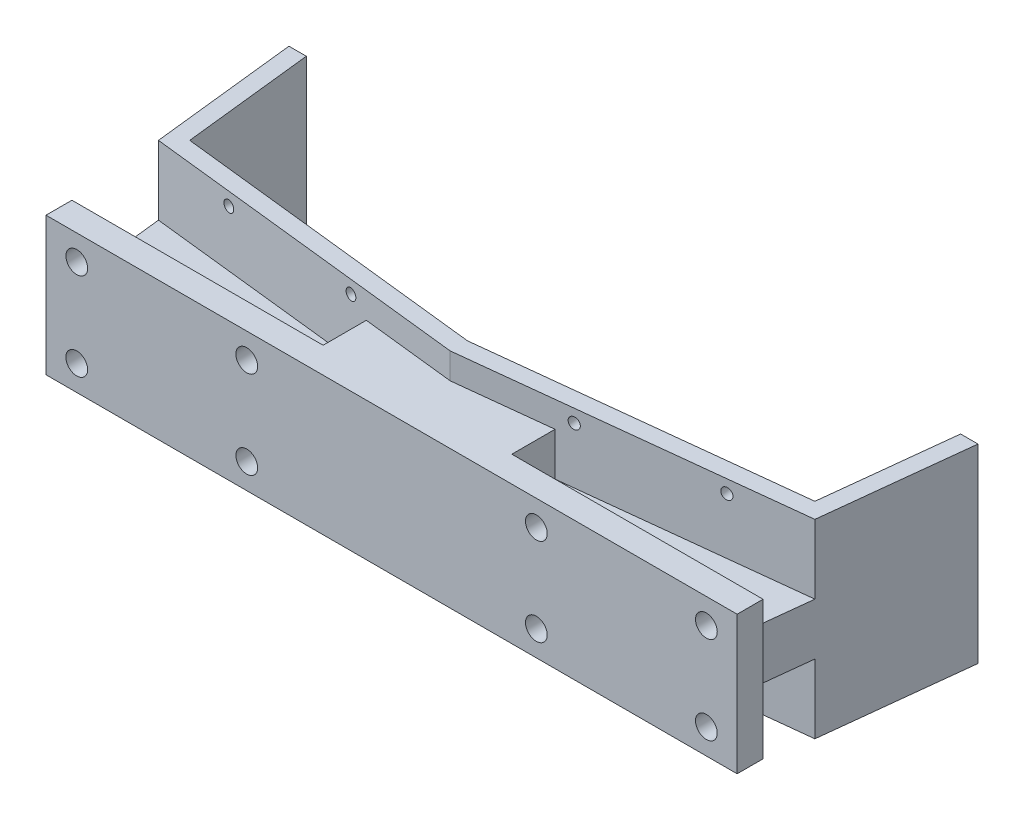
from build123d import *

# Parameters (mm, degrees)
SKETCH1_W                        = 200
SKETCH1_H                        = 40
BOSS_EXTRUDE1_DEPTH              = 12.5
SKETCH3_W                        = 200
SKETCH3_H                        = 12.5
CUT_EXTRUDE1_DEPTH               = 12.5
CUT_EXTRUDE2_REACH               = 107
SKETCH2_R                        = 3.15
SKETCH5_W                        = 200
SKETCH5_H                        = 55
BOSS_EXTRUDE2_DEPTH              = 50
CAVITY1_START                    = -21.65
CAVITY1_DEPTH                    = 43.2999999
CAVITY1_START_2                  = 25.85
CAVITY1_2_DEPTH                  = 1.65
CAVITY1_START_3                  = -27.5
CAVITY1_3_DEPTH                  = 1.6499999
CAVITY1_START_4                  = -25.8500001
CAVITY1_4_DEPTH                  = 51.7000001
CUT_EXTRUDE11_DEPTH              = 55
CUT_EXTRUDE6_REACH               = 216.911
CUT_EXTRUDE6_OFFSET_FROM_SURFACE = 5
SKETCH8_W                        = 62.5
SKETCH8_H                        = 55
CUT_EXTRUDE7_REACH               = 122.136
CUT_EXTRUDE7_OFFSET_FROM_SURFACE = 5
SKETCH9_W                        = 199.70051314
SKETCH9_H                        = 20
CUT_EXTRUDE8_REACH               = 216.911
CUT_EXTRUDE8_OFFSET_FROM_SURFACE = 5
SKETCH11_W                       = 62.5
SKETCH11_H                       = 55
CUT_EXTRUDE9_REACH               = 122.136
CUT_EXTRUDE9_OFFSET_FROM_SURFACE = 5
SKETCH9_2_W                      = 199.70051314
SKETCH9_2_H                      = 20
BOSS_EXTRUDE4_REACH              = 117.136
SKETCH12_W                       = 54.60923652
SKETCH12_H                       = 12.5
BOSS_EXTRUDE5_REACH              = 129.794
CUT_EXTRUDE10_REACH              = 118.931
SKETCH15_R                       = 1.6


with BuildPart() as part:
    # Sketch1 → Boss-Extrude1 (new, symmetric)
    with BuildSketch(Plane.XY):
        Rectangle(SKETCH1_W, SKETCH1_H)
    extrude(amount=BOSS_EXTRUDE1_DEPTH, both=True)

    # Sketch3 → Cut-Extrude1 (cut)
    with BuildSketch(Plane(origin=(0, 20, 0), x_dir=(1, 0, 0), z_dir=(0, 1, 0))):
        with Locations((0, 1.25)):
            Rectangle(SKETCH3_W, SKETCH3_H)
    cut_extrude1 = extrude(amount=-CUT_EXTRUDE1_DEPTH, mode=Mode.SUBTRACT)

    # Mirror1: Cut-Extrude1 across plane
    add(cut_extrude1.mirror(Plane.ZX), mode=Mode.SUBTRACT)

    # Sketch2 → Cut-Extrude2 (cut, up to next)
    with BuildSketch(Plane.XY.offset(12.5), mode=Mode.PRIVATE) as cut_extrude2_sk1:
        with Locations((-91.1, -12.7)):
            Circle(SKETCH2_R)
    cut_extrude2_tool1 = extrude(cut_extrude2_sk1.sketch, amount=-CUT_EXTRUDE2_REACH, mode=Mode.PRIVATE) & part.part
    # Sketch2 → Cut-Extrude2 (cut, up to next)
    with BuildSketch(Plane.XY.offset(12.5), mode=Mode.PRIVATE) as cut_extrude2_sk2:
        with Locations(Location((-41.9, -12.7, 0), (0, 0, 180))):
            Circle(SKETCH2_R)
    cut_extrude2_tool2 = extrude(cut_extrude2_sk2.sketch, amount=-CUT_EXTRUDE2_REACH, mode=Mode.PRIVATE) & part.part
    # Sketch2 → Cut-Extrude2 (cut, up to next)
    with BuildSketch(Plane.XY.offset(12.5), mode=Mode.PRIVATE) as cut_extrude2_sk3:
        with Locations((-41.9, 12.7)):
            Circle(SKETCH2_R)
    cut_extrude2_tool3 = extrude(cut_extrude2_sk3.sketch, amount=-CUT_EXTRUDE2_REACH, mode=Mode.PRIVATE) & part.part
    # Sketch2 → Cut-Extrude2 (cut, up to next)
    with BuildSketch(Plane.XY.offset(12.5), mode=Mode.PRIVATE) as cut_extrude2_sk4:
        with Locations((-91.1, 12.7)):
            Circle(SKETCH2_R)
    cut_extrude2_tool4 = extrude(cut_extrude2_sk4.sketch, amount=-CUT_EXTRUDE2_REACH, mode=Mode.PRIVATE) & part.part
    # Sketch2 → Cut-Extrude2 (cut, up to next)
    with BuildSketch(Plane.XY.offset(12.5), mode=Mode.PRIVATE) as cut_extrude2_sk5:
        with Locations((41.9, -12.7)):
            Circle(SKETCH2_R)
    cut_extrude2_tool5 = extrude(cut_extrude2_sk5.sketch, amount=-CUT_EXTRUDE2_REACH, mode=Mode.PRIVATE) & part.part
    # Sketch2 → Cut-Extrude2 (cut, up to next)
    with BuildSketch(Plane.XY.offset(12.5), mode=Mode.PRIVATE) as cut_extrude2_sk6:
        with Locations(Location((91.1, -12.7, 0), (0, 0, 180))):
            Circle(SKETCH2_R)
    cut_extrude2_tool6 = extrude(cut_extrude2_sk6.sketch, amount=-CUT_EXTRUDE2_REACH, mode=Mode.PRIVATE) & part.part
    # Sketch2 → Cut-Extrude2 (cut, up to next)
    with BuildSketch(Plane.XY.offset(12.5), mode=Mode.PRIVATE) as cut_extrude2_sk7:
        with Locations((91.1, 12.7)):
            Circle(SKETCH2_R)
    cut_extrude2_tool7 = extrude(cut_extrude2_sk7.sketch, amount=-CUT_EXTRUDE2_REACH, mode=Mode.PRIVATE) & part.part
    # Sketch2 → Cut-Extrude2 (cut, up to next)
    with BuildSketch(Plane.XY.offset(12.5), mode=Mode.PRIVATE) as cut_extrude2_sk8:
        with Locations((41.9, 12.7)):
            Circle(SKETCH2_R)
    cut_extrude2_tool8 = extrude(cut_extrude2_sk8.sketch, amount=-CUT_EXTRUDE2_REACH, mode=Mode.PRIVATE) & part.part
    add(cut_extrude2_tool1.solids().sort_by_distance((-91.1, -12.7, 12.5))[0], mode=Mode.SUBTRACT)
    add(cut_extrude2_tool2.solids().sort_by_distance((-41.9, -12.7, 12.5))[0], mode=Mode.SUBTRACT)
    add(cut_extrude2_tool3.solids().sort_by_distance((-41.9, 12.7, 12.5))[0], mode=Mode.SUBTRACT)
    add(cut_extrude2_tool4.solids().sort_by_distance((-91.1, 12.7, 12.5))[0], mode=Mode.SUBTRACT)
    add(cut_extrude2_tool5.solids().sort_by_distance((41.9, -12.7, 12.5))[0], mode=Mode.SUBTRACT)
    add(cut_extrude2_tool6.solids().sort_by_distance((91.1, -12.7, 12.5))[0], mode=Mode.SUBTRACT)
    add(cut_extrude2_tool7.solids().sort_by_distance((91.1, 12.7, 12.5))[0], mode=Mode.SUBTRACT)
    add(cut_extrude2_tool8.solids().sort_by_distance((41.9, 12.7, 12.5))[0], mode=Mode.SUBTRACT)

    # Sketch5 → Boss-Extrude2 (add)
    with BuildSketch(Plane.XY.offset(-7.5)):
        Rectangle(SKETCH5_W, SKETCH5_H)
    extrude(amount=-BOSS_EXTRUDE2_DEPTH)

    # Cavity1: read off the stored shape, not the designer's step
    # Cavity1 outline → Cavity1 (cut)
    with BuildSketch(Plane(origin=(0, 0, 0), x_dir=(1, 0, 0), z_dir=(0, 1, 0)).offset(CAVITY1_START)):
        Polygon((94.166666667, 57.5), (-94.166666667, 57.5), (-90, 20), (0, 10), (90, 20), align=None)
    extrude(amount=CAVITY1_DEPTH, mode=Mode.SUBTRACT)

    # Cavity1 2 outline → Cavity1 2 (cut)
    with BuildSketch(Plane(origin=(0, 0, 0), x_dir=(1, 0, 0), z_dir=(0, 1, 0)).offset(CAVITY1_START_2)):
        Polygon((94.166666667, 57.5), (-94.166666667, 57.5), (-90, 20), (0, 10), (90, 20), align=None)
    extrude(amount=CAVITY1_2_DEPTH, mode=Mode.SUBTRACT)

    # Cavity1 3 outline → Cavity1 3 (cut)
    with BuildSketch(Plane(origin=(0, 0, 0), x_dir=(1, 0, 0), z_dir=(0, 1, 0)).offset(CAVITY1_START_3)):
        Polygon((94.166666667, 57.5), (-94.166666667, 57.5), (-90, 20), (0, 10), (90, 20), align=None)
    extrude(amount=CAVITY1_3_DEPTH, mode=Mode.SUBTRACT)

    # Cavity1 4 outline → Cavity1 4 (cut)
    with BuildSketch(Plane(origin=(0, 0, 0), x_dir=(1, 0, 0), z_dir=(0, 1, 0)).offset(CAVITY1_START_4)):
        Polygon((94.166666667, 57.5), (-94.166666667, 57.5), (-90, 20), (0, 10), (90, 20), align=None)
    extrude(amount=CAVITY1_4_DEPTH, mode=Mode.SUBTRACT)

    # Cavity1 5: loft between two sections, ruled curve by curve
    cavity1_5_from = [
        Edge.make_three_point_arc((-32.731904329, 23.75, -23.698417301), (-30.644748486, 21.65, -23.466511096), (-28.557592643, 23.75, -23.234604892)),
        Edge.make_three_point_arc((-28.557592643, 23.75, -23.234604892), (-30.644748486, 25.85, -23.466511096), (-32.731904329, 23.75, -23.698417301)),
    ]
    cavity1_5_to = [
        Edge.make_three_point_arc((-33.836219589, 23.75, -13.759579954), (-31.749063747, 21.65, -13.52767375), (-29.661907904, 23.75, -13.295767545)),
        Edge.make_three_point_arc((-29.661907904, 23.75, -13.295767545), (-31.749063747, 25.85, -13.52767375), (-33.836219589, 23.75, -13.759579954)),
    ]
    cavity1_5 = Solid(Shell([*[Face.make_surface_from_curves(cavity1_5_from[k], cavity1_5_to[k]) for k in range(2)], Face(Wire(cavity1_5_from)), Face(Wire(cavity1_5_to))]))
    add(cavity1_5)

    # Cavity1 6: loft between two sections, ruled curve by curve
    cavity1_6_from = [
        Edge.make_three_point_arc((-32.731904329, -23.75, -23.698417301), (-30.644748486, -25.85, -23.466511096), (-28.557592643, -23.75, -23.234604892)),
        Edge.make_three_point_arc((-28.557592643, -23.75, -23.234604892), (-30.644748486, -21.65, -23.466511096), (-32.731904329, -23.75, -23.698417301)),
    ]
    cavity1_6_to = [
        Edge.make_three_point_arc((-33.836219589, -23.75, -13.759579954), (-31.749063747, -25.85, -13.52767375), (-29.661907904, -23.75, -13.295767545)),
        Edge.make_three_point_arc((-29.661907904, -23.75, -13.295767545), (-31.749063747, -21.65, -13.52767375), (-33.836219589, -23.75, -13.759579954)),
    ]
    cavity1_6 = Solid(Shell([*[Face.make_surface_from_curves(cavity1_6_from[k], cavity1_6_to[k]) for k in range(2)], Face(Wire(cavity1_6_from)), Face(Wire(cavity1_6_to))]))
    add(cavity1_6)

    # Cavity1 7: loft between two sections, ruled curve by curve
    cavity1_7_from = [
        Edge.make_three_point_arc((-72.487253716, 23.75, -28.115678344), (-70.400097873, 21.65, -27.883772139), (-68.31294203, 23.75, -27.651865935)),
        Edge.make_three_point_arc((-68.31294203, 23.75, -27.651865935), (-70.400097873, 25.85, -27.883772139), (-72.487253716, 23.75, -28.115678344)),
    ]
    cavity1_7_to = [
        Edge.make_three_point_arc((-73.591568976, 23.75, -18.176840997), (-71.504413133, 21.65, -17.944934793), (-69.417257291, 23.75, -17.713028588)),
        Edge.make_three_point_arc((-69.417257291, 23.75, -17.713028588), (-71.504413133, 25.85, -17.944934793), (-73.591568976, 23.75, -18.176840997)),
    ]
    cavity1_7 = Solid(Shell([*[Face.make_surface_from_curves(cavity1_7_from[k], cavity1_7_to[k]) for k in range(2)], Face(Wire(cavity1_7_from)), Face(Wire(cavity1_7_to))]))
    add(cavity1_7)

    # Cavity1 8: loft between two sections, ruled curve by curve
    cavity1_8_from = [
        Edge.make_three_point_arc((-72.487253716, -23.75, -28.115678344), (-70.400097873, -25.85, -27.883772139), (-68.31294203, -23.75, -27.651865935)),
        Edge.make_three_point_arc((-68.31294203, -23.75, -27.651865935), (-70.400097873, -21.65, -27.883772139), (-72.487253716, -23.75, -28.115678344)),
    ]
    cavity1_8_to = [
        Edge.make_three_point_arc((-73.591568976, -23.75, -18.176840997), (-71.504413133, -25.85, -17.944934793), (-69.417257291, -23.75, -17.713028588)),
        Edge.make_three_point_arc((-69.417257291, -23.75, -17.713028588), (-71.504413133, -21.65, -17.944934793), (-73.591568976, -23.75, -18.176840997)),
    ]
    cavity1_8 = Solid(Shell([*[Face.make_surface_from_curves(cavity1_8_from[k], cavity1_8_to[k]) for k in range(2)], Face(Wire(cavity1_8_from)), Face(Wire(cavity1_8_to))]))
    add(cavity1_8)

    # Cavity1 9: loft between two sections, ruled curve by curve
    cavity1_9_from = [
        Edge.make_three_point_arc((32.731904329, 23.75, -23.698417301), (30.644748486, 25.85, -23.466511096), (28.557592643, 23.75, -23.234604892)),
        Edge.make_three_point_arc((28.557592643, 23.75, -23.234604892), (30.644748486, 21.65, -23.466511096), (32.731904329, 23.75, -23.698417301)),
    ]
    cavity1_9_to = [
        Edge.make_three_point_arc((33.836219589, 23.75, -13.759579954), (31.749063747, 25.85, -13.52767375), (29.661907904, 23.75, -13.295767545)),
        Edge.make_three_point_arc((29.661907904, 23.75, -13.295767545), (31.749063747, 21.65, -13.52767375), (33.836219589, 23.75, -13.759579954)),
    ]
    cavity1_9 = Solid(Shell([*[Face.make_surface_from_curves(cavity1_9_from[k], cavity1_9_to[k]) for k in range(2)], Face(Wire(cavity1_9_from)), Face(Wire(cavity1_9_to))]))
    add(cavity1_9)

    # Cavity1 10: loft between two sections, ruled curve by curve
    cavity1_10_from = [
        Edge.make_three_point_arc((32.731904329, -23.75, -23.698417301), (30.644748486, -21.65, -23.466511096), (28.557592643, -23.75, -23.234604892)),
        Edge.make_three_point_arc((28.557592643, -23.75, -23.234604892), (30.644748486, -25.85, -23.466511096), (32.731904329, -23.75, -23.698417301)),
    ]
    cavity1_10_to = [
        Edge.make_three_point_arc((33.836219589, -23.75, -13.759579954), (31.749063747, -21.65, -13.52767375), (29.661907904, -23.75, -13.295767545)),
        Edge.make_three_point_arc((29.661907904, -23.75, -13.295767545), (31.749063747, -25.85, -13.52767375), (33.836219589, -23.75, -13.759579954)),
    ]
    cavity1_10 = Solid(Shell([*[Face.make_surface_from_curves(cavity1_10_from[k], cavity1_10_to[k]) for k in range(2)], Face(Wire(cavity1_10_from)), Face(Wire(cavity1_10_to))]))
    add(cavity1_10)

    # Cavity1 11: loft between two sections, ruled curve by curve
    cavity1_11_from = [
        Edge.make_three_point_arc((72.487253716, 23.75, -28.115678344), (70.400097873, 25.85, -27.883772139), (68.31294203, 23.75, -27.651865935)),
        Edge.make_three_point_arc((68.31294203, 23.75, -27.651865935), (70.400097873, 21.65, -27.883772139), (72.487253716, 23.75, -28.115678344)),
    ]
    cavity1_11_to = [
        Edge.make_three_point_arc((73.591568976, 23.75, -18.176840997), (71.504413133, 25.85, -17.944934793), (69.417257291, 23.75, -17.713028588)),
        Edge.make_three_point_arc((69.417257291, 23.75, -17.713028588), (71.504413133, 21.65, -17.944934793), (73.591568976, 23.75, -18.176840997)),
    ]
    cavity1_11 = Solid(Shell([*[Face.make_surface_from_curves(cavity1_11_from[k], cavity1_11_to[k]) for k in range(2)], Face(Wire(cavity1_11_from)), Face(Wire(cavity1_11_to))]))
    add(cavity1_11)

    # Cavity1 12: loft between two sections, ruled curve by curve
    cavity1_12_from = [
        Edge.make_three_point_arc((72.487253716, -23.75, -28.115678344), (70.400097873, -21.65, -27.883772139), (68.31294203, -23.75, -27.651865935)),
        Edge.make_three_point_arc((68.31294203, -23.75, -27.651865935), (70.400097873, -25.85, -27.883772139), (72.487253716, -23.75, -28.115678344)),
    ]
    cavity1_12_to = [
        Edge.make_three_point_arc((73.591568976, -23.75, -18.176840997), (71.504413133, -21.65, -17.944934793), (69.417257291, -23.75, -17.713028588)),
        Edge.make_three_point_arc((69.417257291, -23.75, -17.713028588), (71.504413133, -25.85, -17.944934793), (73.591568976, -23.75, -18.176840997)),
    ]
    cavity1_12 = Solid(Shell([*[Face.make_surface_from_curves(cavity1_12_from[k], cavity1_12_to[k]) for k in range(2)], Face(Wire(cavity1_12_from)), Face(Wire(cavity1_12_to))]))
    add(cavity1_12)

    # Sketch16 → Cut-Extrude11 (cut)
    with BuildSketch(Plane(origin=(0, 27.5, 0), x_dir=(1, 0, 0), z_dir=(0, 1, 0))):
        Polygon((90.452769257, 19.547230743), (94.725299174, 58), (-94.725299174, 58), (-90.452769257, 19.547230743), (0, 9.496923048), align=None)
    extrude(amount=-CUT_EXTRUDE11_DEPTH, mode=Mode.SUBTRACT)

    # Cut-Extrude6: up to this face of the body (flat: up to its plane, moved by the offset)
    cut_extrude6_end = Plane(part.part.faces().sort_by_distance((-92.561256438, 0, -38.523615372))[0]).offset(-CUT_EXTRUDE6_OFFSET_FROM_SURFACE)
    # Sketch8 → Cut-Extrude6 (cut, up to the picked face)
    with BuildSketch(Plane.ZY.offset(100), mode=Mode.PRIVATE) as cut_extrude6_sk1:
        with Locations((-26.25, 0)):
            Rectangle(SKETCH8_W, SKETCH8_H)
    cut_extrude6_tool1 = split(extrude(cut_extrude6_sk1.sketch, amount=-CUT_EXTRUDE6_REACH, mode=Mode.PRIVATE), bisect_by=cut_extrude6_end, keep=Keep.BOTH, mode=Mode.PRIVATE)
    add(cut_extrude6_tool1.solids().sort_by(Axis((-100, 0, -26.25), (1, 0, 0)))[0], mode=Mode.SUBTRACT)

    # Cut-Extrude7: up to this face of the body (flat: up to its plane, moved by the offset)
    cut_extrude7_end = Plane(part.part.faces().sort_by_distance((-45.226384628, 0, -14.522076895))[0]).offset(-CUT_EXTRUDE7_OFFSET_FROM_SURFACE)
    # Sketch9 → Cut-Extrude7 (cut, up to the picked face)
    with BuildSketch(Plane.XY.offset(-7.5), mode=Mode.PRIVATE) as cut_extrude7_sk1:
        with Locations((0.14974343, -17.5)):
            Rectangle(SKETCH9_W, SKETCH9_H)
    cut_extrude7_tool1 = split(extrude(cut_extrude7_sk1.sketch, amount=-CUT_EXTRUDE7_REACH, mode=Mode.PRIVATE), bisect_by=cut_extrude7_end, keep=Keep.BOTH, mode=Mode.PRIVATE)
    cut_extrude7 = cut_extrude7_tool1.solids().sort_by(Axis((0.149743, -17.5, -7.5), (0, 0, -1)))[0]
    add(cut_extrude7, mode=Mode.SUBTRACT)

    # Cut-Extrude8: up to this face of the body (flat: up to its plane, moved by the offset)
    cut_extrude8_end = Plane(part.part.faces().sort_by_distance((92.561256438, 0, -38.523615372))[0]).offset(-CUT_EXTRUDE8_OFFSET_FROM_SURFACE)
    # Sketch11 → Cut-Extrude8 (cut, up to the picked face)
    with BuildSketch(Plane(origin=(100, 0, 0), x_dir=(0, 0, -1), z_dir=(1, 0, 0)), mode=Mode.PRIVATE) as cut_extrude8_sk1:
        with Locations((26.25, 0)):
            Rectangle(SKETCH11_W, SKETCH11_H)
    cut_extrude8_tool1 = split(extrude(cut_extrude8_sk1.sketch, amount=-CUT_EXTRUDE8_REACH, mode=Mode.PRIVATE), bisect_by=cut_extrude8_end, keep=Keep.BOTH, mode=Mode.PRIVATE)
    add(cut_extrude8_tool1.solids().sort_by(Axis((100, 0, -26.25), (-1, 0, 0)))[0], mode=Mode.SUBTRACT)

    # Cut-Extrude9: up to this face of the body (flat: up to its plane, moved by the offset)
    cut_extrude9_end = Plane(part.part.faces().sort_by_distance((45.226384628, 0, -14.522076895))[0]).offset(-CUT_EXTRUDE9_OFFSET_FROM_SURFACE)
    # Sketch9<2> → Cut-Extrude9 (cut, up to the picked face)
    with BuildSketch(Plane.XY.offset(-7.5), mode=Mode.PRIVATE) as cut_extrude9_sk1:
        with Locations((0.14974343, -17.5)):
            Rectangle(SKETCH9_2_W, SKETCH9_2_H)
    cut_extrude9_tool1 = split(extrude(cut_extrude9_sk1.sketch, amount=-CUT_EXTRUDE9_REACH, mode=Mode.PRIVATE), bisect_by=cut_extrude9_end, keep=Keep.BOTH, mode=Mode.PRIVATE)
    cut_extrude9 = cut_extrude9_tool1.solids().sort_by(Axis((0.149743, -17.5, -7.5), (0, 0, -1)))[0]
    add(cut_extrude9, mode=Mode.SUBTRACT)

    # Sketch12 → Boss-Extrude4 (add, up to next)
    with BuildSketch(Plane.XY.offset(-7.5), mode=Mode.PRIVATE) as boss_extrude4_sk1:
        with Locations((0, -13.75)):
            Rectangle(SKETCH12_W, SKETCH12_H)
    boss_extrude4_tool1 = extrude(boss_extrude4_sk1.sketch, amount=BOSS_EXTRUDE4_REACH, mode=Mode.PRIVATE) - part.part
    boss_extrude4 = boss_extrude4_tool1.solids().sort_by_distance((0, -13.75, -7.5))[0]
    add(boss_extrude4)

    # Sketch14 → Boss-Extrude5 (add, up to next)
    with BuildSketch(Plane.XZ.offset(27.5), mode=Mode.PRIVATE) as boss_extrude5_sk1:
        Polygon((-27.30461826, -7.5), (0, -4.466153527), (27.30461826, -7.5), align=None)
    boss_extrude5_tool1 = extrude(boss_extrude5_sk1.sketch, amount=-BOSS_EXTRUDE5_REACH, mode=Mode.PRIVATE) - part.part
    boss_extrude5 = boss_extrude5_tool1.solids().sort_by_distance((0, -27.5, -6.488718))[0]
    add(boss_extrude5)

    # Mirror7: Cut-Extrude7, Cut-Extrude9, Boss-Extrude4, Boss-Extrude5 across plane
    add(cut_extrude7.mirror(Plane.ZX), mode=Mode.SUBTRACT)
    add(cut_extrude9.mirror(Plane.ZX), mode=Mode.SUBTRACT)
    add(boss_extrude4.mirror(Plane.ZX))
    add(boss_extrude5.mirror(Plane.ZX))

    # Sketch15 → Cut-Extrude10 (cut, up to next)
    with BuildSketch(Plane(origin=(-0.490187582, 0, -4.41168824), x_dir=(0.9938837346736189, 0, -0.11043152607484641), z_dir=(0.11043152607484641, 0, 0.9938837346736189)), mode=Mode.PRIVATE) as cut_extrude10_sk1:
        with Locations((32.99320415, -23.75)):
            Circle(SKETCH15_R)
    cut_extrude10_tool1 = extrude(cut_extrude10_sk1.sketch, amount=-CUT_EXTRUDE10_REACH, mode=Mode.PRIVATE) & part.part
    # Sketch15 → Cut-Extrude10 (cut, up to next)
    with BuildSketch(Plane(origin=(-0.490187582, 0, -4.41168824), x_dir=(0.9938837346736189, 0, -0.11043152607484641), z_dir=(0.11043152607484641, 0, 0.9938837346736189)), mode=Mode.PRIVATE) as cut_extrude10_sk2:
        with Locations((72.99320415, -23.75)):
            Circle(SKETCH15_R)
    cut_extrude10_tool2 = extrude(cut_extrude10_sk2.sketch, amount=-CUT_EXTRUDE10_REACH, mode=Mode.PRIVATE) & part.part
    # Sketch15 → Cut-Extrude10 (cut, up to next)
    with BuildSketch(Plane(origin=(-0.490187582, 0, -4.41168824), x_dir=(0.9938837346736189, 0, -0.11043152607484641), z_dir=(0.11043152607484641, 0, 0.9938837346736189)), mode=Mode.PRIVATE) as cut_extrude10_sk3:
        with Locations((72.99320415, 23.75)):
            Circle(SKETCH15_R)
    cut_extrude10_tool3 = extrude(cut_extrude10_sk3.sketch, amount=-CUT_EXTRUDE10_REACH, mode=Mode.PRIVATE) & part.part
    # Sketch15 → Cut-Extrude10 (cut, up to next)
    with BuildSketch(Plane(origin=(-0.490187582, 0, -4.41168824), x_dir=(0.9938837346736189, 0, -0.11043152607484641), z_dir=(0.11043152607484641, 0, 0.9938837346736189)), mode=Mode.PRIVATE) as cut_extrude10_sk4:
        with Locations((32.99320415, 23.75)):
            Circle(SKETCH15_R)
    cut_extrude10_tool4 = extrude(cut_extrude10_sk4.sketch, amount=-CUT_EXTRUDE10_REACH, mode=Mode.PRIVATE) & part.part
    cut_extrude10_1 = cut_extrude10_tool1.solids().sort_by_distance((32.301221, -23.75, -8.055178))[0]
    add(cut_extrude10_1, mode=Mode.SUBTRACT)
    cut_extrude10_2 = cut_extrude10_tool2.solids().sort_by_distance((72.056571, -23.75, -12.472439))[0]
    add(cut_extrude10_2, mode=Mode.SUBTRACT)
    cut_extrude10_3 = cut_extrude10_tool3.solids().sort_by_distance((72.056571, 23.75, -12.472439))[0]
    add(cut_extrude10_3, mode=Mode.SUBTRACT)
    cut_extrude10_4 = cut_extrude10_tool4.solids().sort_by_distance((32.301221, 23.75, -8.055178))[0]
    add(cut_extrude10_4, mode=Mode.SUBTRACT)
    cut_extrude10 = cut_extrude10_1 + cut_extrude10_2 + cut_extrude10_3 + cut_extrude10_4  # Cut-Extrude10 as one shape, for the pattern or mirror that repeats it

    # Mirror8: Cut-Extrude10 across plane
    add(cut_extrude10.mirror(Plane(origin=(0, 0, 0), x_dir=(0, 0, 1), z_dir=(1, 0, 0))), mode=Mode.SUBTRACT)


solid = part.part
